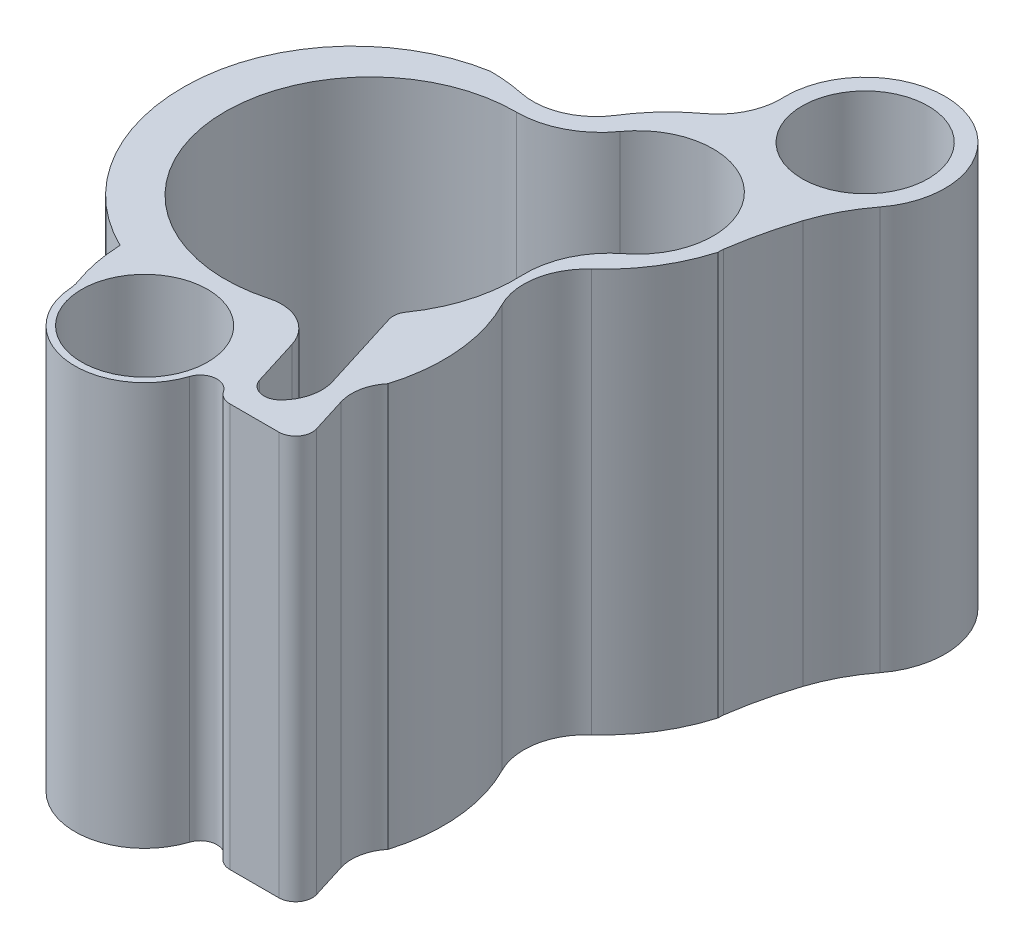
from build123d import *

# Parameters (mm, degrees)
SKETCH1_R               = 4.7625
BOSS_EXTRUDE2_DEPTH     = 30.48
FILLET1_R               = 3.175
FILLET3_R               = 1.27
FILLET4_R               = 3.175
FILLET5_R               = 1.27
FILLET6_R               = 1.27
BOSS_EXTRUDE9_START     = -30.48
BOSS_EXTRUDE9_DEPTH     = 30.48
CUT_EXTRUDE6_START      = -30.48
CUT_EXTRUDE6_DEPTH      = 30.48
FILLET9_R               = 6.35
CUT_EXTRUDE7_DEPTH      = 44.536935081
CUT_EXTRUDE7_DEPTH_BACK = 44.536935081
BOSS_EXTRUDE11_START    = -30.48
SKETCH4_R               = 4.7625
BOSS_EXTRUDE11_DEPTH    = 30.48
FILLET10_R              = 12.7
FILLET11_R              = 12.7
CUT_EXTRUDE8_DEPTH      = 47.823412819
CUT_EXTRUDE8_DEPTH_BACK = 47.823412819
FILLET12_R              = 12.7


with BuildPart() as part:
    # Sketch1 → Boss-Extrude2 (new body)
    with BuildSketch(Plane(origin=(0, 0, 0), x_dir=(1, 0, 0), z_dir=(0, 1, 0))):
        with BuildLine():
            Line((11.860213807, -12.884548704), (13.754545104, -18.945407466))
            Line((13.754545104, -18.945407466), (7.404545104, -18.945407466))
            Line((7.404545104, -18.945407466), (6.640447212, -16.500698134))
            ThreePointArc((6.640447212, -16.500698134), (5.961240353, -16.792309403), (5.2705, -17.055438375))
            ThreePointArc((5.2705, -17.055438375), (0, -22.325938375), (-5.2705, -17.055438375))
            ThreePointArc((-5.2705, -17.055438375), (-5.919586773, -14.929400926), (-6.188032569, -12.722755117))
            ThreePointArc((-6.188032569, -12.722755117), (-14.1478, 0), (-6.188032569, 12.722755117))
            ThreePointArc((-6.188032569, 12.722755117), (-5.919586773, 14.929400926), (-5.2705, 17.055438375))
            ThreePointArc((-5.2705, 17.055438375), (0, 22.325938375), (5.2705, 17.055438375))
            ThreePointArc((5.2705, 17.055438375), (12.040379738, 12.314885712), (16.362502035, 5.2705))
            ThreePointArc((16.362502035, 5.2705), (21.633002035, 0), (16.362502035, -5.2705))
            ThreePointArc((16.362502035, -5.2705), (14.592418813, -9.361982053), (11.860213807, -12.884548704))
        make_face()
        with Locations(Location((0, 17.055438375, 0), (0, 0, 90))):
            Circle(SKETCH1_R, mode=Mode.SUBTRACT)
        with Locations(Location((16.362502035, 0, 0), (0, 0, 90))):
            Circle(SKETCH1_R, mode=Mode.SUBTRACT)
        with Locations(Location((0, -17.055438375, 0), (0, 0, 90))):
            Circle(SKETCH1_R, mode=Mode.SUBTRACT)
        with BuildLine():
            Line((5.737156066, -9.353468881), (8.338191551, -17.675407466))
            Line((8.338191551, -17.675407466), (12.027017511, -17.675407466))
            Line((12.027017511, -17.675407466), (8.623309815, -6.785342119))
            ThreePointArc((8.623309815, -6.785342119), (-7.294145861, 8.197424961), (5.737156066, -9.353468881))
        make_face(mode=Mode.SUBTRACT)
    extrude(amount=BOSS_EXTRUDE2_DEPTH)

    # Fillet1
    # the kernel refuses this fillet: 3.175 mm, written as the material it adds along each edge
    with BuildSketch(Plane(origin=(-6.188032569, 0, -12.722755117), x_dir=(-0.8747186698844794, 0, 0.4846310437389738), z_dir=(0, 1, 0))) as fillet1_piece_1:
        with BuildLine():
            CenterArc((1.675106808, -3.170499128), FILLET1_R, 93.05116293, 49.316383357)
            ThreePointArc((-0.839315123, -1.231863693), (-0.401568779, -0.628256415), (0, 0))
            ThreePointArc((0, 0), (0.753054473, -0.020055884), (1.506108946, 0))
        make_face()
    extrude(amount=30.48)
    with BuildSketch(Plane(origin=(-5.2705, 0, -17.055438375), x_dir=(-0.35770128840140486, 0, 0.9338360607065755), z_dir=(0, 1, 0))) as fillet1_piece_2:
        with BuildLine():
            CenterArc((0.51828136, -3.174477714), FILLET1_R, 91.039263795, 15.495369937)
            ThreePointArc((-0.385307362, -0.130770695), (-0.191391238, -0.069105054), (0, 0))
            ThreePointArc((0, 0), (0.230347271, -0.002089143), (0.460694542, 0))
        make_face()
    extrude(amount=30.48)
    with BuildSketch(Plane(origin=(5.2705, 0, -17.055438375), x_dir=(-0.12720688847868244, 0, -0.9918762057452392), z_dir=(0, 1, 0))) as fillet1_piece_3:
        with BuildLine():
            CenterArc((1.744769682, -3.149206953), FILLET1_R, 97.308218729, 47.663807195)
            ThreePointArc((-0.855148612, -1.326832167), (-0.414685297, -0.671723102), (0, 0))
            ThreePointArc((0, 0), (0.670443906, -0.042816458), (1.340887811, 0))
        make_face()
    extrude(amount=30.48)
    with BuildSketch(Plane(origin=(16.362502035, 0, -5.2705), x_dir=(-0.3771647323765371, 0, -0.9261461896759794), z_dir=(0, 1, 0))) as fillet1_piece_4:
        with BuildLine():
            CenterArc((1.804499427, -3.172306197), FILLET1_R, 92.360366346, 49.97819677)
            ThreePointArc((-0.70894152, -1.232399084), (-0.312723775, -0.640214629), (0, 0))
            ThreePointArc((0, 0), (0.8368693, -0.017240341), (1.673738599, 0))
        make_face()
    extrude(amount=30.48)
    with BuildSketch(Plane(origin=(16.362502035, 0, 5.2705), x_dir=(0.9898341628287173, 0, -0.14222633404954374), z_dir=(0, 1, 0))) as fillet1_piece_5:
        with BuildLine():
            CenterArc((1.950776398, -3.142723467), FILLET1_R, 98.176695151, 51.81827723)
            ThreePointArc((-0.798714948, -1.554982197), (-0.380235314, -0.787313176), (0, 0))
            ThreePointArc((0, 0), (0.749603894, -0.053579045), (1.499207787, 0))
        make_face()
    extrude(amount=30.48)
    with BuildSketch(Plane(origin=(11.860213807, 0, 12.884548704), x_dir=(0.29831988928740816, 0, 0.9544659468286695), z_dir=(0, 1, 0))) as fillet1_piece_6:
        with BuildLine():
            CenterArc((1.816465361, 3.175), FILLET1_R, 213.037149694, 56.962850306)
            ThreePointArc((-0.845191928, 1.444044923), (-0.405599886, 0.731970177), (0, 0))
            Line((0, 0), (1.816465361, 0))
        make_face()
    extrude(amount=30.48)
    with BuildSketch(Plane(origin=(5.2705, 0, 17.055438375), x_dir=(0.9268908474954334, 0, -0.37533099636080863), z_dir=(0, 1, 0))) as fillet1_piece_7:
        with BuildLine():
            CenterArc((1.820147869, -3.156511003), FILLET1_R, 96.186334825, 46.370096176)
            ThreePointArc((-0.700651409, -1.226175281), (-0.30907029, -0.636661485), (0, 0))
            ThreePointArc((0, 0), (0.73900137, -0.015364429), (1.47800274, 0))
        make_face()
    extrude(amount=30.48)
    with BuildSketch(Plane(origin=(-5.2705, 0, 17.055438375), x_dir=(0.038601082712793416, 0, 0.999254700471006), z_dir=(0, 1, 0))) as fillet1_piece_8:
        with BuildLine():
            CenterArc((0.52945245, -3.172633674), FILLET1_R, 92.212228742, 15.495369937)
            ThreePointArc((-0.436253651, -0.148061518), (-0.217455401, -0.076009068), (0, 0))
            ThreePointArc((0, 0), (0.203447006, -0.003928101), (0.406894013, 0))
        make_face()
    extrude(amount=30.48)
    # the kernel refuses this fillet: 3.175 mm, written as the material it takes off along each edge
    with BuildSketch(Plane(origin=(5.737156066, -8.75064331, 9.353468881), x_dir=(0.29831988928740744, 0, 0.9544659468286697), z_dir=(0, 1, 0))) as fillet1_2_piece_1:
        with BuildLine():
            CenterArc((3.500257324, -3.175), FILLET1_R, 90, 88.017608619)
            ThreePointArc((0.327157544, -3.065169276), (0.271751922, -1.521038893), (0, 0))
            Line((0, 0), (3.500257324, 0))
        make_face()
    extrude(amount=47.98128662, mode=Mode.SUBTRACT)

    # Fillet3
    fillet3_edges = [part.edges().sort_by_distance(p)[0] for p in [
        (13.754545104, 15.24, 18.945407466),
        (7.404545104, 15.24, 18.945407466),
    ]]
    fillet(fillet3_edges, radius=FILLET3_R)

    # Fillet4
    # the kernel refuses this fillet: 3.175 mm, written as the material it adds along each edge
    with BuildSketch(Plane(origin=(12.027017511, 0, 17.675407466), x_dir=(-0.29831988928740777, 0, -0.9544659468286695), z_dir=(0, 1, 0))) as fillet4_piece_1:
        with BuildLine():
            CenterArc((4.256556411, 3.175), FILLET4_R, 173.746252409, 96.253747591)
            Line((1.100450152, 3.520858762), (1.037328027, 3.527775938))
            ThreePointArc((1.037328027, 3.527775938), (0.489616488, 1.779372694), (-0.060608588, 0.018943313))
            Line((-0.060608588, 0.018943313), (0, -0.0635))
            Line((0, -0.0635), (4.256556411, -0.0635))
            Line((4.256556411, -0.0635), (4.256556411, 0))
        make_face()
    extrude(amount=30.48)

    # Fillet5
    fillet5_edges = [part.edges().sort_by_distance(p)[0] for p in [
        (8.338191551, 15.24, 17.675407466),
    ]]
    fillet(fillet5_edges, radius=FILLET5_R)

    # Fillet6
    fillet6_edges = [part.edges().sort_by_distance(p)[0] for p in [
        (6.640447212, 15.24, 16.500698134),
        (8.623309815, 15.24, 6.785342119),
    ]]
    fillet(fillet6_edges, radius=FILLET6_R)

    # Sketch2 → Boss-Extrude9 (add)
    with BuildSketch(Plane(origin=(0, 30.48, 0), x_dir=(1, 0, 0), z_dir=(0, 1, 0)).offset(BOSS_EXTRUDE9_START)):
        with BuildLine():
            ThreePointArc((7.943426233, 15.662766674), (13.175324303, 14.973004025), (15.611766116, 10.291948459))
            ThreePointArc((15.611766116, 10.291948459), (15.492196473, 9.129027942), (15.138490831, 8.014768839))
            ThreePointArc((15.138490831, 8.014768839), (15.444654673, 7.422560084), (15.731226864, 6.820626626))
            ThreePointArc((15.731226864, 6.820626626), (15.781158654, 6.716236617), (15.834861283, 6.61373547))
            ThreePointArc((15.834861283, 6.61373547), (16.614943687, 8.379799111), (16.881766116, 10.291948459))
            ThreePointArc((16.881766116, 10.291948459), (13.476256049, 16.290071233), (6.580412696, 16.439470316))
            ThreePointArc((6.580412696, 16.439470316), (6.637545403, 16.407150651), (6.69533405, 16.376019005))
            ThreePointArc((6.69533405, 16.376019005), (7.325689413, 16.030433186), (7.943426233, 15.662766674))
        make_face()
    extrude(amount=BOSS_EXTRUDE9_DEPTH)

    # Sketch2<12> → Cut-Extrude6 (cut)
    with BuildSketch(Plane(origin=(0, 30.48, 0), x_dir=(1, 0, 0), z_dir=(0, 1, 0)).offset(CUT_EXTRUDE6_START)):
        with BuildLine():
            ThreePointArc((15.138490831, 8.014768839), (12.043511127, 12.311557951), (7.943426233, 15.662766674))
            ThreePointArc((7.943426233, 15.662766674), (5.173639716, 13.509603196), (4.183683511, 10.143920944))
            ThreePointArc((4.183683511, 10.143920944), (7.605607592, 7.90930294), (9.972426866, 4.577449316))
            ThreePointArc((9.972426866, 4.577449316), (13.062589614, 5.533925069), (15.138490831, 8.014768839))
        make_face()
    extrude(amount=CUT_EXTRUDE6_DEPTH, mode=Mode.SUBTRACT)

    # Fillet9
    fillet9_edges = [part.edges().sort_by_distance(p)[0] for p in [
        (6.580412696, 15.24, -16.439470316),
        (15.834861283, 15.24, -6.61373547),
        (9.972426866, 15.24, -4.577449316),
        (4.183683511, 15.24, -10.143920944),
    ]]
    fillet(fillet9_edges, radius=FILLET9_R)

    # Sketch3 → Cut-Extrude7 (cut, two sides: drawn at the far end of the back side and taken through both)
    with BuildSketch(Plane(origin=(0, 30.48, 0), x_dir=(1, 0, 0), z_dir=(0, 1, 0)).offset(-CUT_EXTRUDE7_DEPTH_BACK)):
        with BuildLine():
            Line((-7.505454184, 11.992847966), (-2.296148987, 12.883016287))
            ThreePointArc((-2.296148987, 12.883016287), (2.423426985, 12.955632538), (4.7625, 17.055438375))
            Line((4.7625, 17.055438375), (9.734184624, 17.275056095))
            ThreePointArc((9.734184624, 17.275056095), (-1.208436668, 22.214922829), (-7.505454184, 11.992847966))
        make_face()
    extrude(amount=CUT_EXTRUDE7_DEPTH + CUT_EXTRUDE7_DEPTH_BACK, mode=Mode.SUBTRACT)

    # Sketch4 → Boss-Extrude11 (add)
    with BuildSketch(Plane(origin=(0, 30.48, 0), x_dir=(1, 0, 0), z_dir=(0, 1, 0)).offset(BOSS_EXTRUDE11_START)):
        with BuildLine():
            ThreePointArc((16.86594215, 9.822043775), (17.712963238, 13.767422556), (19.105519309, 17.554802394))
            ThreePointArc((19.105519309, 17.554802394), (17.767180424, 27.639662161), (9.18901652, 22.17059903))
            ThreePointArc((9.18901652, 22.17059903), (9.198998035, 21.978650402), (9.201259866, 21.786455734))
            ThreePointArc((9.201259866, 21.786455734), (7.906472539, 18.553470941), (4.7625, 17.055438375))
            Line((4.7625, 17.055438375), (9.734184624, 17.275056095))
            ThreePointArc((9.734184624, 17.275056095), (14.943475982, 15.121124841), (16.86594215, 9.822043775))
        make_face()
        with Locations(Location((15.22151652, 22.17059903, 0), (0, 0, 270))):
            Circle(SKETCH4_R, mode=Mode.SUBTRACT)
    extrude(amount=BOSS_EXTRUDE11_DEPTH)

    # Fillet10
    fillet10_edges = [part.edges().sort_by_distance(p)[0] for p in [
        (4.7625, 15.24, -17.055438375),
        (19.105519309, 15.24, -17.554802394),
        (-7.505454184, 15.24, -11.992847966),
    ]]
    fillet(fillet10_edges, radius=FILLET10_R)

    # Fillet11
    # the kernel refuses this fillet: 12.7 mm, written as the material it takes off along each edge
    with BuildSketch(Plane(origin=(-2.296148987, -3.519120011, -12.883016287), x_dir=(0.9377307104980771, 0, 0.3473630875449655), z_dir=(0, 1, 0))) as fillet11_piece_1:
        with BuildLine():
            CenterArc((3.28451201, -12.560548615), FILLET11_R, 98.498560753, 11.829576247)
            Line((-1.127419619, -0.651524335), (-1.215658252, -0.413343849))
            ThreePointArc((-1.215658252, -0.413343849), (-0.690798794, -0.105843114), (-0.127088985, 0.219919053))
            Line((-0.127088985, 0.219919053), (0.03753728, 0.251210972))
            ThreePointArc((0.03753728, 0.251210972), (0.703824002, 0.201705731), (1.370110724, 0.251210972))
            Line((1.370110724, 0.251210972), (1.407648004, 0))
        make_face()
    extrude(amount=37.518240022, mode=Mode.SUBTRACT)

    # Sketch6 → Cut-Extrude8 (cut, two sides: drawn at the far end of the back side and taken through both)
    with BuildSketch(Plane(origin=(0, 30.48, 0), x_dir=(1, 0, 0), z_dir=(0, 1, 0)).offset(-CUT_EXTRUDE8_DEPTH_BACK)):
        Polygon((16.86594215, 9.822043775), (16.362502035, -4.7625), (12.986367949, -11.647054469), (20.424487513, -6.754467336), (23.855992578, 4.7625), align=None)
    extrude(amount=CUT_EXTRUDE8_DEPTH + CUT_EXTRUDE8_DEPTH_BACK, mode=Mode.SUBTRACT)

    # Fillet12
    # the kernel refuses this fillet: 12.7 mm, written as the material it takes off along each edge
    with BuildSketch(Plane(origin=(16.362502035, -19.16953501, 4.7625), x_dir=(-0.44029942358179885, 0, 0.897850999661712), z_dir=(0, 1, 0))) as fillet12_piece_1:
        with BuildLine():
            CenterArc((9.725565923, -12.532184847), FILLET12_R, 99.324611407, 43.978540744)
            Line((-0.457402302, -4.942905689), (-0.661061666, -4.791120106))
            ThreePointArc((-0.661061666, -4.791120106), (0.213304295, -2.51235476), (-0.228054154, -0.111836054))
            Line((-0.228054154, -0.111836054), (0, 0.254))
            ThreePointArc((0, 0.254), (3.833907002, 0.254), (7.626658966, 0.250643697))
            Line((7.626658966, 0.250643697), (7.667814004, 0))
        make_face()
    extrude(amount=68.819070021, mode=Mode.SUBTRACT)
    with BuildSketch(Plane(origin=(16.690901757, 42.122927143, -4.751164054), x_dir=(-0.9451540669307225, 0, 0.3266248456016706), z_dir=(0, -1, 0))) as fillet12_piece_2:
        with BuildLine():
            CenterArc((8.690437274, 11.688849387), FILLET12_R, 215.318855045, 31.663113493)
            Line((-1.67209449, 4.346647031), (-1.879345125, 4.199802984))
            ThreePointArc((-1.879345125, 4.199802984), (-1.073111415, 2.082128235), (-0.23706417, -0.09119528))
            Line((-0.23706417, -0.09119528), (0.099319283, -0.233776988))
            ThreePointArc((0.099319283, -0.233776988), (1.862236559, 0.12518148), (3.625153834, -0.233776988))
            Line((3.625153834, -0.233776988), (3.724473117, 0))
        make_face()
    extrude(amount=53.765854287, mode=Mode.SUBTRACT)


solid = part.part
